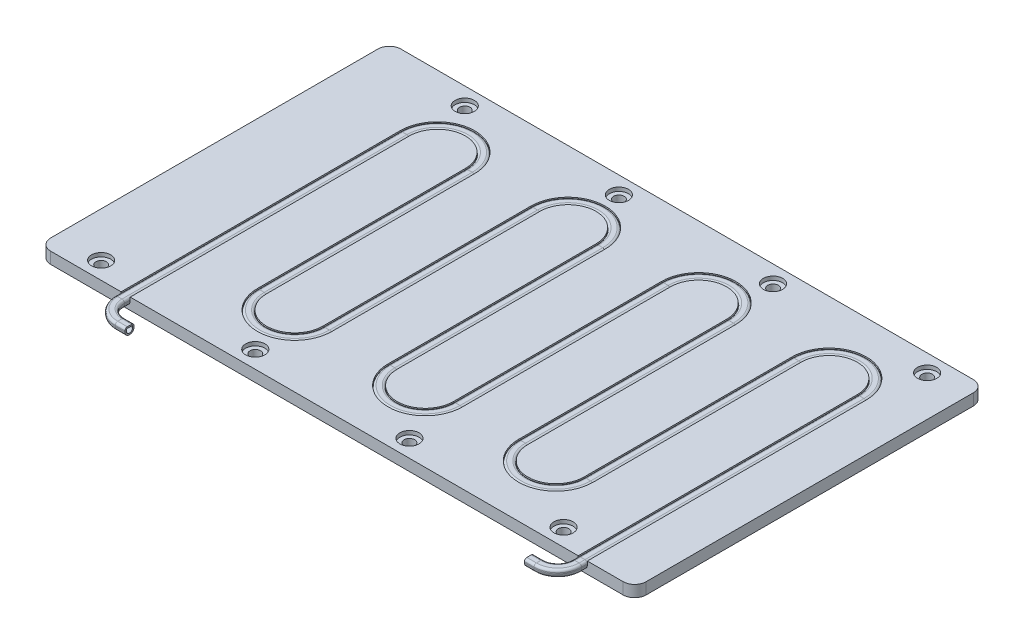
from build123d import *

# Parameters (mm, degrees)
SKETCH1_W           = 310
SKETCH1_H           = 182.3
BOSS_EXTRUDE1_DEPTH = 6
HOLE1_D             = 5.5
HOLE1_DEPTH         = 6
HOLE1_CBORE_D       = 10
HOLE1_CBORE_DEPTH   = 2
HOLE1_TIP           = 1.652366702
FILLET1_R           = 6


with BuildPart() as part:
    # Sketch1 → Boss-Extrude1 (new body)
    with BuildSketch(Plane(origin=(0, 0, 0), x_dir=(1, 0, 0), z_dir=(0, 1, 0))):
        Rectangle(SKETCH1_W, SKETCH1_H)
    extrude(amount=BOSS_EXTRUDE1_DEPTH)

    # Hole1
    with Locations(Plane(origin=(0, 6, 0), x_dir=(1, 0, 0), z_dir=(0, 1, 0))):
        with Locations((-131.75, -82.15), (-106.75, 82.15), (-26.5, 82.15), (53.75, 82.15), (134, 82.15), (-51.5, -82.15), (28.75, -82.15), (109, -82.15)):
            CounterBoreHole(HOLE1_D / 2, HOLE1_CBORE_D / 2, HOLE1_CBORE_DEPTH, depth=HOLE1_DEPTH)
            with Locations((0, 0, -(HOLE1_DEPTH + HOLE1_TIP / 2))):  # 118° drill point
                Cone(0, HOLE1_D / 2, HOLE1_TIP, mode=Mode.SUBTRACT)

    # Fillet1
    fillet1_edges = [part.edges().sort_by_distance(p)[0] for p in [
        (155, 3, -91.15),
        (155, 3, 91.15),
        (-155, 3, -91.15),
        (-155, 3, 91.15),
    ]]
    fillet(fillet1_edges, radius=FILLET1_R)

    # Cut-Sweep1: sweep along a path in Sketch6
    with BuildLine(Plane(origin=(0, 6, 0), x_dir=(1, 0, 0), z_dir=(0, 1, 0))) as cut_sweep1_path:
        Line((-95, -104.15), (-100, -104.15))
        ThreePointArc((-100, -104.15), (-107.071067812, -101.221067812), (-110, -94.15))
        Line((-110, -94.15), (-110, -91.15))
        Line((-110, -91.15), (-110, 54.15))
        ThreePointArc((-110, 54.15), (-93, 71.15), (-76, 54.15))
        Line((-76, 54.15), (-76, -54.15))
        ThreePointArc((-76, -54.15), (-59, -71.15), (-42, -54.15))
        Line((-42, -54.15), (-42, 54.15))
        ThreePointArc((-42, 54.15), (-25, 71.15), (-8, 54.15))
        Line((-8, 54.15), (-8, -54.15))
        ThreePointArc((-8, -54.15), (9, -71.15), (26, -54.15))
        Line((26, -54.15), (26, 54.15))
        ThreePointArc((26, 54.15), (43, 71.15), (60, 54.15))
        Line((60, 54.15), (60, -54.15))
        ThreePointArc((60, -54.15), (77, -71.15), (94, -54.15))
        Line((94, -54.15), (94, 54.15))
        ThreePointArc((94, 54.15), (111, 71.15), (128, 54.15))
        Line((128, 54.15), (128, -91.15))
        Line((128, -91.15), (128, -94.15))
        ThreePointArc((128, -94.15), (125.071067812, -101.221067812), (118, -104.15))
        Line((118, -104.15), (113, -104.15))
    # Sketch7 → Cut-Sweep1 (sweep, cut)
    with BuildSketch(Plane.XY.offset(91.15)):
        with BuildLine():
            Line((-112.38125, 4.2), (-112.38125, 6))
            Line((-112.38125, 6), (-107.61875, 6))
            Line((-107.61875, 6), (-107.61875, 4.2))
            ThreePointArc((-107.61875, 4.2), (-110, 1.81875), (-112.38125, 4.2))
        make_face()
    sweep(path=cut_sweep1_path.line, mode=Mode.SUBTRACT)


with BuildPart() as body_2:
    # Sweep1: sweep along a path in Sketch6<2>
    with BuildLine(Plane(origin=(0, 6, 0), x_dir=(1, 0, 0), z_dir=(0, 1, 0))) as sweep1_path:
        Line((-95, -104.15), (-100, -104.15))
        ThreePointArc((-100, -104.15), (-107.071067812, -101.221067812), (-110, -94.15))
        Line((-110, -94.15), (-110, -91.15))
        Line((-110, -91.15), (-110, 54.15))
        ThreePointArc((-110, 54.15), (-93, 71.15), (-76, 54.15))
        Line((-76, 54.15), (-76, -54.15))
        ThreePointArc((-76, -54.15), (-59, -71.15), (-42, -54.15))
        Line((-42, -54.15), (-42, 54.15))
        ThreePointArc((-42, 54.15), (-25, 71.15), (-8, 54.15))
        Line((-8, 54.15), (-8, -54.15))
        ThreePointArc((-8, -54.15), (9, -71.15), (26, -54.15))
        Line((26, -54.15), (26, 54.15))
        ThreePointArc((26, 54.15), (43, 71.15), (60, 54.15))
        Line((60, 54.15), (60, -54.15))
        ThreePointArc((60, -54.15), (77, -71.15), (94, -54.15))
        Line((94, -54.15), (94, 54.15))
        ThreePointArc((94, 54.15), (111, 71.15), (128, 54.15))
        Line((128, 54.15), (128, -91.15))
        Line((128, -91.15), (128, -94.15))
        ThreePointArc((128, -94.15), (125.071067812, -101.221067812), (118, -104.15))
        Line((118, -104.15), (113, -104.15))
    # Sketch8 → Sweep1 (sweep)
    with BuildSketch(Plane.XY.offset(91.15)):
        with BuildLine():
            Line((-112.38125, 4.2), (-112.38125, 4.75))
            ThreePointArc((-112.38125, 4.75), (-112.015133476, 5.633883476), (-111.13125, 6))
            Line((-111.13125, 6), (-108.86875, 6))
            ThreePointArc((-108.86875, 6), (-107.984866524, 5.633883476), (-107.61875, 4.75))
            Line((-107.61875, 4.75), (-107.61875, 4.2))
            ThreePointArc((-107.61875, 4.2), (-110, 1.81875), (-112.38125, 4.2))
        make_face()
        with BuildLine():
            Line((-111.61925, 4.2), (-111.61925, 4.838))
            ThreePointArc((-111.61925, 4.838), (-111.502092712, 5.120842712), (-111.21925, 5.238))
            Line((-111.21925, 5.238), (-108.78075, 5.238))
            ThreePointArc((-108.78075, 5.238), (-108.497907288, 5.120842712), (-108.38075, 4.838))
            Line((-108.38075, 4.838), (-108.38075, 4.2))
            ThreePointArc((-108.38075, 4.2), (-110, 2.58075), (-111.61925, 4.2))
        make_face(mode=Mode.SUBTRACT)
    sweep(path=sweep1_path.line)


solid = Compound([part.part, body_2.part])
